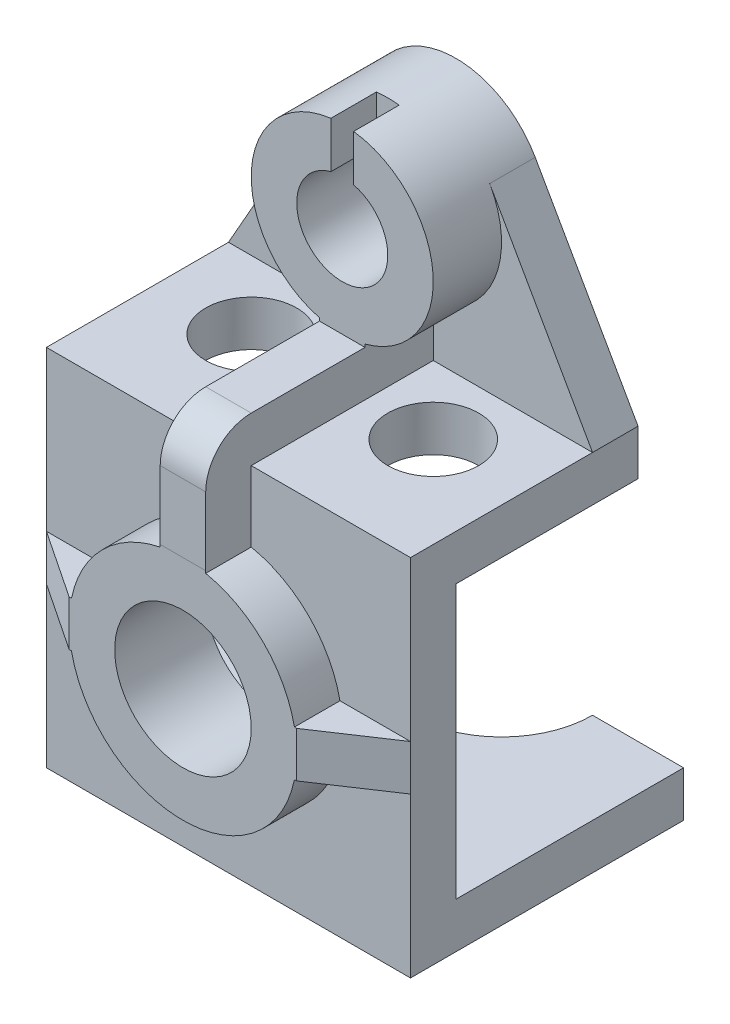
from build123d import *

# Parameters (mm, degrees)
EXTRUDE_THIN1_DEPTH = 80
BOSS_EXTRUDE1_DEPTH = 10
SKETCH2_3_R         = 20
BOSS_EXTRUDE2_DEPTH = 25
CUT_EXTRUDE1_REACH  = 158.605
SKETCH3_3_R         = 10
SKETCH3_3_W         = 5
SKETCH3_3_H         = 10.317541634
CUT_EXTRUDE2_DEPTH  = 10
HOLE1_D             = 40
HOLE1_DEPTH         = 10
SKETCH6_R           = 25
BOSS_EXTRUDE3_DEPTH = 10
RIB17_START         = -5
RIB17_DEPTH         = 10
RIB18_START         = -5
RIB18_DEPTH         = 10
RIB26_START         = -5
RIB26_DEPTH         = 10
HOLE2_D             = 30
HOLE3_D             = 20
HOLE3_DEPTH         = 10


with BuildPart() as part:
    # Sketch1 → Extrude-Thin1 (new body)
    with BuildSketch(Plane(origin=(0, 0, 0), x_dir=(0, 0, -1), z_dir=(1, 0, 0))):
        Polygon((0, 0), (-60, 0), (-60, 80), (-10, 80), (-10, 70), (-50, 70), (-50, 10), (0, 10), align=None)
    extrude(amount=-EXTRUDE_THIN1_DEPTH)

    # Sketch2 → Boss-Extrude1 (add)
    with BuildSketch(Plane(origin=(0, 0, 10), x_dir=(-1, 0, 0), z_dir=(0, 0, -1))):
        with BuildLine():
            Line((40, 80), (80, 80))
            Line((80, 80), (57.398181668, 119.864242224))
            ThreePointArc((57.398181668, 119.864242224), (59.338609482, 115.100802223), (60, 110))
            ThreePointArc((60, 110), (54.142135624, 95.857864376), (40, 90))
            Line((40, 90), (40, 80))
        make_face()
        with BuildLine():
            Line((0, 80), (40, 80))
            Line((40, 80), (40, 90))
            ThreePointArc((40, 90), (22.718726255, 99.932349938), (22.601818332, 119.864242224))
            Line((22.601818332, 119.864242224), (0, 80))
        make_face()
    extrude(amount=-BOSS_EXTRUDE1_DEPTH)

    # Sketch2<3> → Boss-Extrude2 (add)
    with BuildSketch(Plane(origin=(0, 0, 10), x_dir=(-1, 0, 0), z_dir=(0, 0, -1))):
        with Locations((40, 110)):
            Circle(SKETCH2_3_R)
    extrude(amount=-BOSS_EXTRUDE2_DEPTH)

    # Sketch3 → Cut-Extrude1 (cut, up to next)
    with BuildSketch(Plane.XY.offset(35), mode=Mode.PRIVATE) as cut_extrude1_sk1:
        with BuildLine():
            ThreePointArc((-37.5, 119.682458366), (-40, 120), (-42.5, 119.682458366))
            Line((-42.5, 119.682458366), (-37.5, 119.682458366))
        make_face()
    cut_extrude1_tool1 = extrude(cut_extrude1_sk1.sketch, amount=-CUT_EXTRUDE1_REACH, mode=Mode.PRIVATE) & part.part
    # Sketch3 → Cut-Extrude1 (cut, up to next)
    with BuildSketch(Plane.XY.offset(35), mode=Mode.PRIVATE) as cut_extrude1_sk2:
        with BuildLine():
            Line((-37.5, 119.682458366), (-42.5, 119.682458366))
            ThreePointArc((-42.5, 119.682458366), (-46.123724357, 102.09430585), (-30, 110))
            ThreePointArc((-30, 110), (-32.09430585, 116.123724357), (-37.5, 119.682458366))
        make_face()
    cut_extrude1_tool2 = extrude(cut_extrude1_sk2.sketch, amount=-CUT_EXTRUDE1_REACH, mode=Mode.PRIVATE) & part.part
    add(cut_extrude1_tool1.solids().sort_by_distance((-40, 119.809649, 35))[0], mode=Mode.SUBTRACT)
    add(cut_extrude1_tool2.solids().sort_by_distance((-40, 109.96673, 35))[0], mode=Mode.SUBTRACT)

    # Sketch3<3> → Cut-Extrude2 (cut)
    with BuildSketch(Plane.XY.offset(35)):
        with Locations((-40, 110)):
            Circle(SKETCH3_3_R)
        with Locations((-40, 124.841229183)):
            Rectangle(SKETCH3_3_W, SKETCH3_3_H)
    extrude(amount=-CUT_EXTRUDE2_DEPTH, mode=Mode.SUBTRACT)

    # Hole1
    with Locations(Plane(origin=(0, 10, 0), x_dir=(1, 0, 0), z_dir=(0, 1, 0))):
        with Locations((-40, 0)):
            Hole(HOLE1_D / 2, depth=HOLE1_DEPTH)

    # Sketch6 → Boss-Extrude3 (add)
    with BuildSketch(Plane.XY.offset(60)):
        with Locations((-40, 40)):
            Circle(SKETCH6_R)
    extrude(amount=BOSS_EXTRUDE3_DEPTH)

    # Rib17: read off the stored shape, not the designer's step
    # Rib17 outline → Rib17 (add)
    with BuildSketch(Plane(origin=(0, 40, 0), x_dir=(-1, 0, 0), z_dir=(0, -1, 0)).offset(RIB17_START)):
        Polygon((15.505102572, -70), (15.505102572, -60), (0, -60), (15, -70), align=None)
    extrude(amount=RIB17_DEPTH)

    # Rib18: read off the stored shape, not the designer's step
    # Rib18 outline → Rib18 (add)
    with BuildSketch(Plane(origin=(0, 40, 0), x_dir=(-1, 0, 0), z_dir=(0, -1, 0)).offset(RIB18_START)):
        Polygon((80, -60), (64.494897428, -60), (64.494897428, -70), (65, -70), align=None)
    extrude(amount=RIB18_DEPTH)

    # Rib26: read off the stored shape, not the designer's step
    # Rib26 outline → Rib26 (add)
    with BuildSketch(Plane(origin=(-40, 0, 0), x_dir=(0, 0, -1), z_dir=(1, 0, 0)).offset(RIB26_START)):
        with BuildLine():
            Line((-70, 80), (-70, 64.494897428))
            Line((-70, 64.494897428), (-60, 64.494897428))
            Line((-60, 64.494897428), (-60, 80))
            Line((-60, 80), (-20, 80))
            Line((-20, 80), (-20, 90.635083269))
            Line((-20, 90.635083269), (-35, 90.635083269))
            Line((-35, 90.635083269), (-35, 90))
            Line((-35, 90), (-60, 90))
            ThreePointArc((-60, 90), (-67.071067812, 87.071067812), (-70, 80))
        make_face()
    extrude(amount=RIB26_DEPTH)

    # Hole2 (through all)
    with Locations(Plane.XY.offset(70)):
        with Locations((-40, 40)):
            Hole(HOLE2_D / 2)

    # Hole3
    with Locations(Plane(origin=(0, 80, 0), x_dir=(1, 0, 0), z_dir=(0, 1, 0))):
        with Locations((-20, -35)):
            hole3 = Hole(HOLE3_D / 2, depth=HOLE3_DEPTH)

    # Mirror1: Hole3 across plane
    add(hole3.mirror(Plane(origin=(-40, 0, 0), x_dir=(0, 0, 1), z_dir=(1, 0, 0))), mode=Mode.SUBTRACT)


solid = part.part
